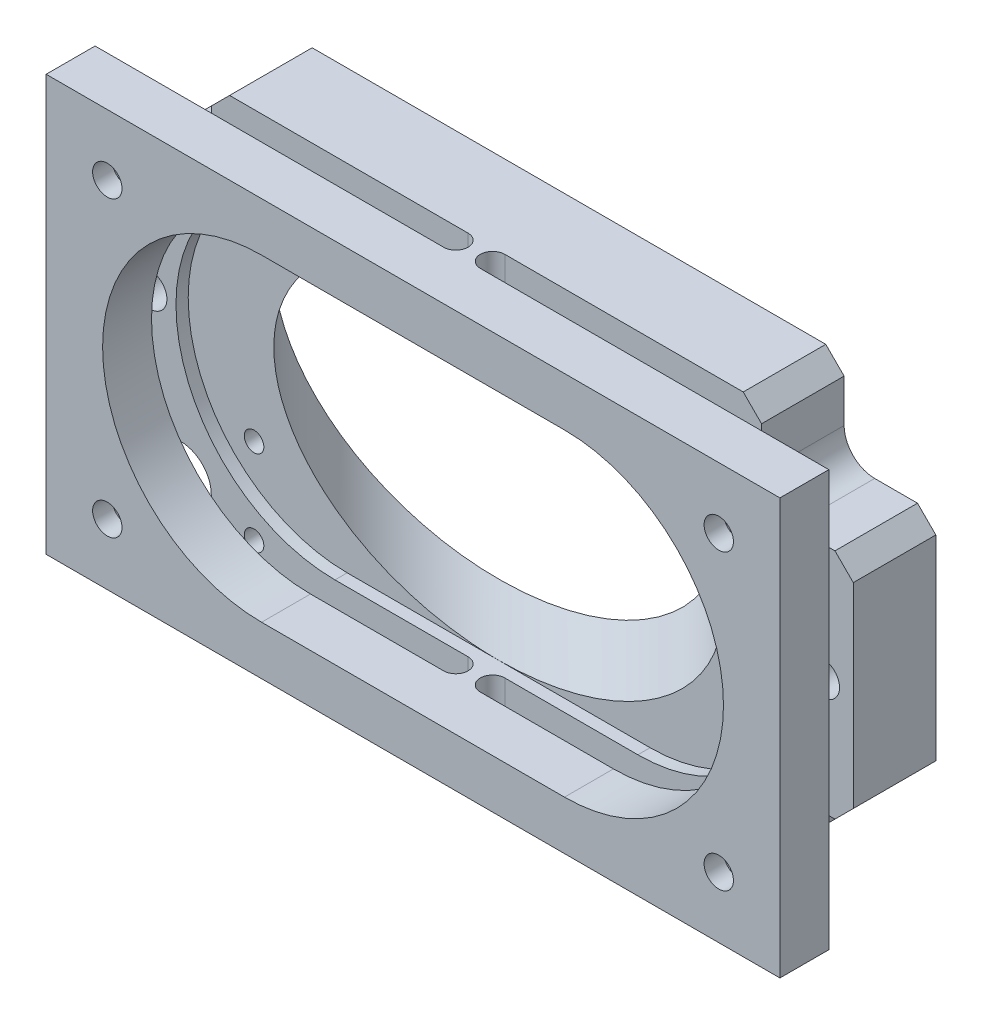
from build123d import *

# Parameters (mm, degrees)
SKETCH1_W                                    = 75
SKETCH1_H                                    = 12
BOSS_EXTRUDE1_DEPTH                          = 17
CUT_EXTRUDE1_REACH                           = 52.973
CUT_EXTRUDE2_DEPTH                           = 1
CUT_EXTRUDE2_DEPTH_BACK                      = 1
SKETCH5_W                                    = 4
SKETCH5_H                                    = 10
SKETCH22_W                                   = 75
SKETCH22_H                                   = 34
BOSS_EXTRUDE2_DEPTH                          = 0.75
CUT_EXTRUDE3_DEPTH                           = 65.057103431
CUT_EXTRUDE3_DEPTH_BACK                      = 65.057103431
SKETCH4_R                                    = 13
CUT_EXTRUDE4_START                           = -6
CUT_EXTRUDE4_DEPTH                           = 6
SKETCH7_W                                    = 7.5
SKETCH7_H                                    = 34
CUT_EXTRUDE5_DEPTH                           = 44.102349124
CBORE_FOR_M2_HEX_SOCKET_HEAD_CAP_SCR_2_COUNT = 2
CBORE_FOR_M2_HEX_SOCKET_HEAD_CAP_SCR_2_PITCH = 50
CBORE_FOR_M2_HEX_SOCKET_HEAD_CAP_SCR_3_COUNT = 2
CBORE_FOR_M2_HEX_SOCKET_HEAD_CAP_SCR_3_PITCH = 55.461698495
CBORE_FOR_M2_HEX_SOCKET_HEAD_CAP_SCR_4_COUNT = 2
CBORE_FOR_M2_HEX_SOCKET_HEAD_CAP_SCR_4_PITCH = 24
CUT_EXTRUDE8_REACH                           = 38.764
FILLET1_R                                    = 2.5
CIRPATTERN1_COUNT                            = 2
FILLET1_OF_CIRPATTERN1_R                     = 2.5
MIRROR1_START                                = -6.75
MIRROR1_DEPTH                                = 6.75
CUT_EXTRUDE11_START                          = -1
CUT_EXTRUDE11_DEPTH                          = 1
M2_TAPPED_HOLE1_D                            = 1.6
M2_TAPPED_HOLE1_DEPTH                        = 3.2
M2_TAPPED_HOLE1_TIP                          = 0.480688495
M2_TAPPED_HOLE2_D                            = 1.6
M2_TAPPED_HOLE2_DEPTH                        = 6.75
M3X0_25_TAPPED_HOLE1_D                       = 2.75
M3X0_25_TAPPED_HOLE1_DEPTH                   = 6.75


# Read off the part's stored shape, not the designer's step: Mirror1
with BuildPart() as part:
    # Sketch1 → Boss-Extrude1 (new, symmetric)
    with BuildSketch(Plane(origin=(0, 0, 0), x_dir=(1, 0, 0), z_dir=(0, 1, 0))):
        Rectangle(SKETCH1_W, SKETCH1_H)
    extrude(amount=BOSS_EXTRUDE1_DEPTH, both=True)

    # Sketch2 → Cut-Extrude1 (cut, up to next)
    with BuildSketch(Plane(origin=(0, 17, 0), x_dir=(1, 0, 0), z_dir=(0, 1, 0)), mode=Mode.PRIVATE) as cut_extrude1_sk1:
        with BuildLine():
            Line((-37.5, 0), (-1.5, 0))
            ThreePointArc((-1.5, 0), (-0.5, -1), (-1.5, -2))
            Line((-1.5, -2), (-37.5, -2))
            ThreePointArc((-37.5, -2), (-38.5, -1), (-37.5, 0))
        make_face()
    cut_extrude1_tool1 = extrude(cut_extrude1_sk1.sketch, amount=-CUT_EXTRUDE1_REACH, mode=Mode.PRIVATE) & part.part
    # Sketch2 → Cut-Extrude1 (cut, up to next)
    with BuildSketch(Plane(origin=(0, 17, 0), x_dir=(1, 0, 0), z_dir=(0, 1, 0)), mode=Mode.PRIVATE) as cut_extrude1_sk2:
        with BuildLine():
            Line((37.5, -2), (1.5, -2))
            ThreePointArc((1.5, -2), (0.5, -1), (1.5, 0))
            Line((1.5, 0), (37.5, 0))
            ThreePointArc((37.5, 0), (38.5, -1), (37.5, -2))
        make_face()
    cut_extrude1_tool2 = extrude(cut_extrude1_sk2.sketch, amount=-CUT_EXTRUDE1_REACH, mode=Mode.PRIVATE) & part.part
    add(cut_extrude1_tool1.solids().sort_by_distance((-19.5, 17, 1))[0], mode=Mode.SUBTRACT)
    add(cut_extrude1_tool2.solids().sort_by_distance((19.5, 17, 1))[0], mode=Mode.SUBTRACT)

    # Sketch5 → Cut-Extrude2 (cut, two sides: drawn at the far end of the back side and taken through both)
    with BuildSketch(Plane(origin=(0, 0, 0), x_dir=(0, 0, -1), z_dir=(1, 0, 0)).offset(-CUT_EXTRUDE2_DEPTH_BACK)):
        with Locations((-1, 0)):
            Rectangle(SKETCH5_W, SKETCH5_H)
    extrude(amount=CUT_EXTRUDE2_DEPTH + CUT_EXTRUDE2_DEPTH_BACK, mode=Mode.SUBTRACT)

    # Sketch22 → Boss-Extrude2 (add)
    with BuildSketch(Plane(origin=(0, 0, -6), x_dir=(-1, 0, 0), z_dir=(0, 0, -1))):
        Rectangle(SKETCH22_W, SKETCH22_H)
    extrude(amount=BOSS_EXTRUDE2_DEPTH)

    # Sketch4 → Cut-Extrude3 (cut, two sides: drawn at the far end of the back side and taken through both)
    with BuildSketch(Plane(origin=(18.75, 0, 18.75), x_dir=(0, 1, 0), z_dir=(0.7071067811865488, 0, 0.7071067811865464)).offset(-CUT_EXTRUDE3_DEPTH_BACK)):
        with Locations(Location((0, -0.707106781, 0), (0, 0, 270))):
            Circle(SKETCH4_R)
    extrude(amount=CUT_EXTRUDE3_DEPTH + CUT_EXTRUDE3_DEPTH_BACK, mode=Mode.SUBTRACT)

    # Sketch6 → Cut-Extrude4 (cut)
    with BuildSketch(Plane.XY.offset(6).offset(CUT_EXTRUDE4_START)):
        with BuildLine():
            Line((-12.384776311, 13), (12.384776311, 13))
            ThreePointArc((12.384776311, 13), (25.384776311, 0), (12.384776311, -13))
            Line((12.384776311, -13), (-12.384776311, -13))
            ThreePointArc((-12.384776311, -13), (-25.384776311, 0), (-12.384776311, 13))
        make_face()
    extrude(amount=CUT_EXTRUDE4_DEPTH, mode=Mode.SUBTRACT)

    # Sketch7 → Cut-Extrude5 (cut, through all)
    with BuildSketch(Plane(origin=(0, 0, -6.75), x_dir=(-1, 0, 0), z_dir=(0, 0, -1))):
        with Locations((33.75, 0)):
            Rectangle(SKETCH7_W, SKETCH7_H)
        with Locations((-33.75, 0)):
            Rectangle(SKETCH7_W, SKETCH7_H)
    extrude(amount=-CUT_EXTRUDE5_DEPTH, mode=Mode.SUBTRACT)

    # Sketch13 → CBORE for M2 Hex Socket Head Cap Screw1 (revolve, cut)
    with BuildSketch(Plane(origin=(-25, 12, 2), x_dir=(0, 1, 0), z_dir=(1, 0, 0))):
        Polygon((0, 0), (0, 4), (1.2, 4), (1.2, 2.4), (2.2, 2.4), (2.2, 0), align=None)
    cbore_for_m2_hex_socket_head_cap_screw1 = revolve(axis=Axis((-25, 12, -4.35), (0, 0, 1)), mode=Mode.SUBTRACT)

    # CBORE for M2 Hex Socket Head Cap Scr 2: CBORE for M2 Hex Socket Head Cap Screw1 ×2
    with Locations(*[(i * CBORE_FOR_M2_HEX_SOCKET_HEAD_CAP_SCR_2_PITCH, 0, 0) for i in range(1, CBORE_FOR_M2_HEX_SOCKET_HEAD_CAP_SCR_2_COUNT)]):
        add(cbore_for_m2_hex_socket_head_cap_screw1, mode=Mode.SUBTRACT)

    # CBORE for M2 Hex Socket Head Cap Scr 3: CBORE for M2 Hex Socket Head Cap Screw1 ×2
    with Locations(*[Vector(0.9015230574682735, -0.43273106758477137, 0) * (i * CBORE_FOR_M2_HEX_SOCKET_HEAD_CAP_SCR_3_PITCH) for i in range(1, CBORE_FOR_M2_HEX_SOCKET_HEAD_CAP_SCR_3_COUNT)]):
        add(cbore_for_m2_hex_socket_head_cap_screw1, mode=Mode.SUBTRACT)

    # CBORE for M2 Hex Socket Head Cap Scr 4: CBORE for M2 Hex Socket Head Cap Screw1 ×2
    with Locations(*[(0, -i * CBORE_FOR_M2_HEX_SOCKET_HEAD_CAP_SCR_4_PITCH, 0) for i in range(1, CBORE_FOR_M2_HEX_SOCKET_HEAD_CAP_SCR_4_COUNT)]):
        add(cbore_for_m2_hex_socket_head_cap_screw1, mode=Mode.SUBTRACT)

    # Sketch15 → Cut-Extrude8 (cut, up to next)
    with BuildSketch(Plane(origin=(0, 0, -6.75), x_dir=(-1, 0, 0), z_dir=(0, 0, -1)), mode=Mode.PRIVATE) as cut_extrude8_sk1:
        Polygon((30, 17), (21, 17), (22.5, 15.5), (22.5, 9.5), (28.5, 9.5), (30, 8), align=None)
    cut_extrude8_tool1 = extrude(cut_extrude8_sk1.sketch, amount=-CUT_EXTRUDE8_REACH, mode=Mode.PRIVATE) & part.part
    cut_extrude8 = cut_extrude8_tool1.solids().sort_by_distance((-26.230769, 13.230769, -6.75))[0]
    add(cut_extrude8, mode=Mode.SUBTRACT)

    # Fillet1
    fillet1_edges = [part.edges().sort_by_distance(p)[0] for p in [
        (-22.5, 9.5, -3.375),
    ]]
    fillet(fillet1_edges, radius=FILLET1_R)

    # CirPattern1: Cut-Extrude8 ×2 about axis
    cirpattern1_axis = Axis((0, 0, 0), (0, 0, 1))
    for i in range(1, CIRPATTERN1_COUNT):
        add(cut_extrude8.rotate(cirpattern1_axis, i * 360 / CIRPATTERN1_COUNT), mode=Mode.SUBTRACT)

    # Fillet1 of CirPattern1
    fillet1_of_cirpattern1_edges = [part.edges().sort_by_distance(p)[0] for p in [
        (22.5, -9.5, -3.375),
    ]]
    fillet(fillet1_of_cirpattern1_edges, radius=FILLET1_OF_CIRPATTERN1_R)

    # Mirror1 outline → Mirror1 (cut)
    with BuildSketch(Plane.XY.offset(MIRROR1_START)):
        with BuildLine():
            Line((25, 9.5), (28.5, 9.5))
            Line((28.5, 9.5), (30, 8))
            Line((30, 8), (30, 17))
            Line((30, 17), (21, 17))
            Line((21, 17), (22.5, 15.5))
            Line((22.5, 15.5), (22.5, 12))
            ThreePointArc((22.5, 12), (23.232233047, 10.232233047), (25, 9.5))
        make_face()
        with BuildLine():
            Line((-22.5, -15.5), (-22.5, -12))
            ThreePointArc((-22.5, -12), (-23.232233047, -10.232233047), (-25, -9.5))
            Line((-25, -9.5), (-28.5, -9.5))
            Line((-28.5, -9.5), (-30, -8))
            Line((-30, -8), (-30, -17))
            Line((-30, -17), (-21, -17))
            Line((-21, -17), (-22.5, -15.5))
        make_face()
    extrude(amount=MIRROR1_DEPTH, mode=Mode.SUBTRACT)

    # Sketch20 → Cut-Extrude11 (cut)
    with BuildSketch(Plane.XY.offset(CUT_EXTRUDE11_START)):
        with BuildLine():
            Line((-12.384776311, -13), (12.384776311, -13))
            ThreePointArc((12.384776311, -13), (25.384776311, 0), (12.384776311, 13))
            Line((12.384776311, 13), (-12.384776311, 13))
            ThreePointArc((-12.384776311, 13), (-25.384776311, 0), (-12.384776311, -13))
        make_face()
    extrude(amount=CUT_EXTRUDE11_DEPTH, mode=Mode.SUBTRACT)

    # M2 Tapped Hole1
    with Locations(Plane.XY.offset(-1)):
        with Locations((20, 7.5), (-20, -7.5), (-20, 7.5), (20, -7.5)):
            Hole(M2_TAPPED_HOLE1_D / 2, depth=M2_TAPPED_HOLE1_DEPTH)
            with Locations((0, 0, -(M2_TAPPED_HOLE1_DEPTH + M2_TAPPED_HOLE1_TIP / 2))):  # 118° drill point
                Cone(0, M2_TAPPED_HOLE1_D / 2, M2_TAPPED_HOLE1_TIP, mode=Mode.SUBTRACT)

    # M2 Tapped Hole2
    with Locations(Plane(origin=(0, 0, -6.75), x_dir=(-1, 0, 0), z_dir=(0, 0, -1))):
        with Locations((19, 13.5), (-19, -13.5), (-19, 13.5), (19, -13.5)):
            Hole(M2_TAPPED_HOLE2_D / 2, depth=M2_TAPPED_HOLE2_DEPTH)

    # M3x0.25 Tapped Hole1
    with Locations(Plane(origin=(0, 0, -6.75), x_dir=(-1, 0, 0), z_dir=(0, 0, -1))):
        with Locations((-27.5, 0), (27.5, 0)):
            Hole(M3X0_25_TAPPED_HOLE1_D / 2, depth=M3X0_25_TAPPED_HOLE1_DEPTH)


solid = part.part
